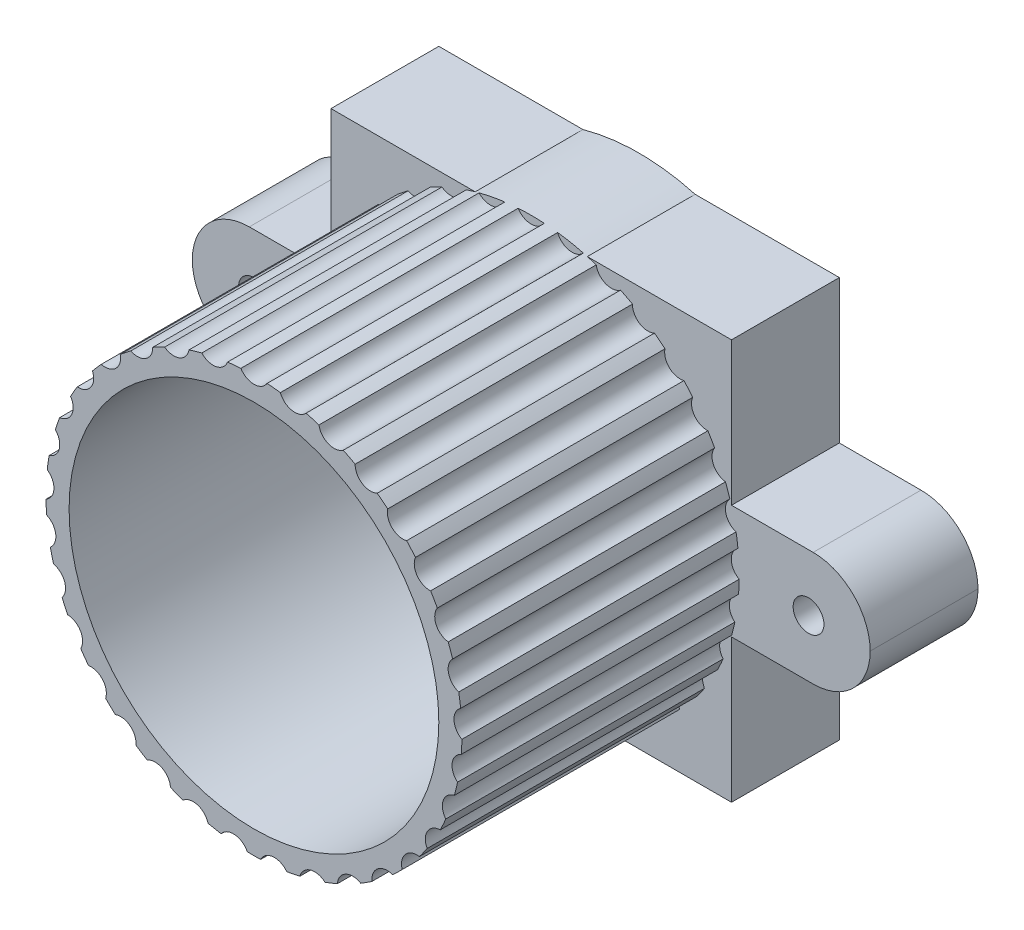
from build123d import *

# Parameters (mm, degrees)
SKETCH1_W                = 13
SKETCH1_H                = 13
BOSS_EXTRUDE1_DEPTH      = 3.5
SKETCH2_W                = 22
SKETCH2_H                = 3.7
BOSS_EXTRUDE2_DEPTH      = 3.5
FILLET1_R                = 1.85
SKETCH3_R                = 0.5
CUT_EXTRUDE1_DEPTH       = 3.5
BOSS_EXTRUDE3_DEPTH      = 9
BOSS_EXTRUDE3_DEPTH_BACK = 3.5
SKETCH4_R                = 6.75
SKETCH5_R                = 0.5
CUT_EXTRUDE2_DEPTH       = 9
SKETCH6_R                = 6
CUT_EXTRUDE3_DEPTH       = 9


with BuildPart() as part:
    # Sketch1 → Boss-Extrude1 (new body)
    with BuildSketch(Plane.XY):
        Rectangle(SKETCH1_W, SKETCH1_H)
    extrude(amount=BOSS_EXTRUDE1_DEPTH)

    # Sketch2 → Boss-Extrude2 (add)
    with BuildSketch(Plane.XY.offset(3.5)):
        Rectangle(SKETCH2_W, SKETCH2_H)
    extrude(amount=-BOSS_EXTRUDE2_DEPTH)

    # Fillet1
    fillet1_edges = [part.edges().sort_by_distance(p)[0] for p in [
        (11, -1.85, 1.75),
        (11, 1.85, 1.75),
        (-11, -1.85, 1.75),
        (-11, 1.85, 1.75),
    ]]
    fillet(fillet1_edges, radius=FILLET1_R - 0.0001)  # a hair under: the kernel refuses the full size

    # Sketch3 → Cut-Extrude1 (cut)
    with BuildSketch(Plane.XY.offset(3.5)):
        with Locations((-9, 0)):
            Circle(SKETCH3_R)
        with Locations((9, 0)):
            Circle(SKETCH3_R)
    extrude(amount=-CUT_EXTRUDE1_DEPTH, mode=Mode.SUBTRACT)

    # Sketch4 → Boss-Extrude3 (add, two sides: drawn at the far end of the back side and taken through both)
    with BuildSketch(Plane.XY.offset(3.5).offset(-BOSS_EXTRUDE3_DEPTH_BACK)):
        Circle(SKETCH4_R)
    extrude(amount=BOSS_EXTRUDE3_DEPTH + BOSS_EXTRUDE3_DEPTH_BACK)

    # Sketch5 → Cut-Extrude2 (cut)
    with BuildSketch(Plane.XY.offset(12.5)):
        with Locations((0, 7)):
            Circle(SKETCH5_R)
        with Locations((1.324758711, 6.873500881)):
            Circle(SKETCH5_R)
        with Locations((2.60163719, 6.498575531)):
            Circle(SKETCH5_R)
        with Locations((3.784485722, 5.88877473)):
            Circle(SKETCH5_R)
        with Locations((4.83055308, 5.066138267)):
            Circle(SKETCH5_R)
        with Locations((5.702031664, 4.060398367)):
            Circle(SKETCH5_R)
        with Locations((6.367423967, 2.907905091)):
            Circle(SKETCH5_R)
        with Locations((6.802680978, 1.650312549)):
            Circle(SKETCH5_R)
        with Locations((6.992071374, 0.333073411)):
            Circle(SKETCH5_R)
        with Locations((6.928750093, -0.996203868)):
            Circle(SKETCH5_R)
        with Locations((6.615005731, -2.289475743)):
            Circle(SKETCH5_R)
        with Locations((6.062177826, -3.5)):
            Circle(SKETCH5_R)
        with Locations((5.29024702, -4.584025138)):
            Circle(SKETCH5_R)
        with Locations((4.327112904, -5.502371663)):
            Circle(SKETCH5_R)
        with Locations((3.207585652, -6.221848141)):
            Circle(SKETCH5_R)
        with Locations((1.972127898, -6.716450815)):
            Circle(SKETCH5_R)
        with Locations((0.665392303, -6.968303458)):
            Circle(SKETCH5_R)
        with Locations((-0.665392303, -6.968303458)):
            Circle(SKETCH5_R)
        with Locations((-1.972127898, -6.716450815)):
            Circle(SKETCH5_R)
        with Locations((-3.207585652, -6.221848141)):
            Circle(SKETCH5_R)
        with Locations((-4.327112904, -5.502371663)):
            Circle(SKETCH5_R)
        with Locations((-5.29024702, -4.584025138)):
            Circle(SKETCH5_R)
        with Locations((-6.062177826, -3.5)):
            Circle(SKETCH5_R)
        with Locations((-6.615005731, -2.289475743)):
            Circle(SKETCH5_R)
        with Locations((-6.928750093, -0.996203868)):
            Circle(SKETCH5_R)
        with Locations((-6.992071374, 0.333073411)):
            Circle(SKETCH5_R)
        with Locations((-6.802680978, 1.650312549)):
            Circle(SKETCH5_R)
        with Locations((-6.367423967, 2.907905091)):
            Circle(SKETCH5_R)
        with Locations((-5.702031664, 4.060398367)):
            Circle(SKETCH5_R)
        with Locations((-4.83055308, 5.066138267)):
            Circle(SKETCH5_R)
        with Locations((-3.784485722, 5.88877473)):
            Circle(SKETCH5_R)
        with Locations((-2.60163719, 6.498575531)):
            Circle(SKETCH5_R)
        with Locations((-1.324758711, 6.873500881)):
            Circle(SKETCH5_R)
    extrude(amount=-CUT_EXTRUDE2_DEPTH, mode=Mode.SUBTRACT)

    # Sketch6 → Cut-Extrude3 (cut)
    with BuildSketch(Plane.XY.offset(12.5)):
        Circle(SKETCH6_R)
    extrude(amount=-CUT_EXTRUDE3_DEPTH, mode=Mode.SUBTRACT)


solid = part.part
